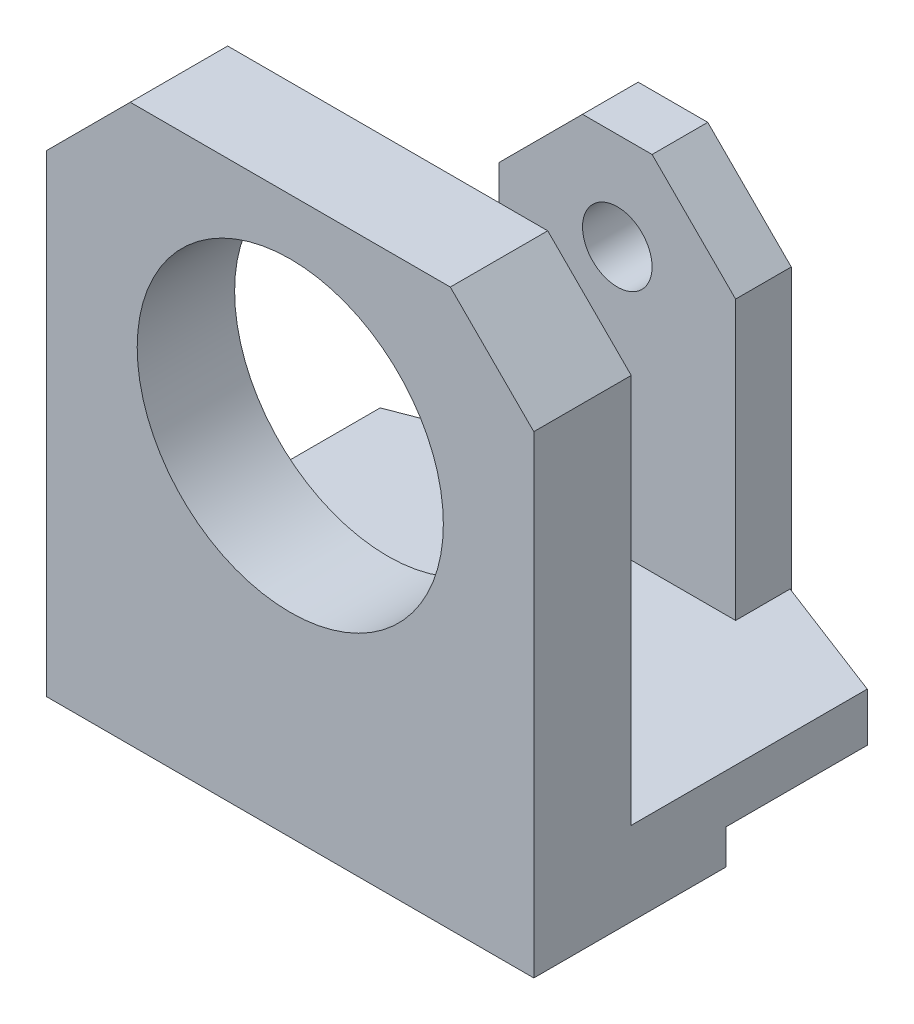
from build123d import *

# Parameters (mm, degrees)
SKETCH1_W           = 35
SKETCH1_H           = 40
SKETCH1_R           = 11
BOSS_EXTRUDE1_DEPTH = 7
SKETCH2_W           = 35
SKETCH2_H           = 6
BOSS_EXTRUDE2_DEPTH = 16.5
SKETCH3_W           = 17
SKETCH3_H           = 32
SKETCH3_R           = 2.5
BOSS_EXTRUDE3_DEPTH = 4
CHAMFER1_SIZE       = 10.2
CHAMFER1_SIZE_2     = 3.915413157
CHAMFER2_SIZE       = 6
SKETCH4_W           = 35
SKETCH4_H           = 2.5
CUT_EXTRUDE1_DEPTH  = 13.7


with BuildPart() as part:
    # Sketch1 → Boss-Extrude1 (new body)
    with BuildSketch(Plane.XY):
        with Locations((0, -5)):
            Rectangle(SKETCH1_W, SKETCH1_H)
        Circle(SKETCH1_R, mode=Mode.SUBTRACT)
    extrude(amount=BOSS_EXTRUDE1_DEPTH)

    # Sketch2 → Boss-Extrude2 (add)
    with BuildSketch(Plane(origin=(0, 0, 0), x_dir=(-1, 0, 0), z_dir=(0, 0, -1))):
        with Locations((0, -22)):
            Rectangle(SKETCH2_W, SKETCH2_H)
    extrude(amount=BOSS_EXTRUDE2_DEPTH)

    # Sketch3 → Boss-Extrude3 (add)
    with BuildSketch(Plane(origin=(0, 0, -16.5), x_dir=(-1, 0, 0), z_dir=(0, 0, -1))):
        with Locations((0, -9)):
            Rectangle(SKETCH3_W, SKETCH3_H)
        Circle(SKETCH3_R, mode=Mode.SUBTRACT)
    extrude(amount=BOSS_EXTRUDE3_DEPTH)

    # Chamfer1
    # the kernel refuses this chamfer: 10.2, 3.915413157 mm, written as the material it adds along each edge
    with BuildSketch(Plane(origin=(-8.5, -19, -16.5), x_dir=(-0.9999045356599434, 0, 0.013817364679016049), z_dir=(0, -1, 0))) as chamfer1_piece_1_section:
        Polygon((CHAMFER1_SIZE * 0.99990453566, CHAMFER1_SIZE * 0.013817364679), (-CHAMFER1_SIZE_2 * 0.0138173646803, CHAMFER1_SIZE_2 * 0.999904535752), (0, 0), align=None)
    chamfer1_piece_1 = extrude(amount=6, mode=Mode.PRIVATE)
    chamfer1_piece_1 = split(chamfer1_piece_1, bisect_by=Plane(origin=(-17.5, -22, -17.821300415), z_dir=(1, 0, 0)), keep=Keep.TOP, mode=Mode.PRIVATE)
    add(chamfer1_piece_1)
    with BuildSketch(Plane(origin=(8.5, -25, -16.5), x_dir=(0.9999045356599434, 0, 0.013817364679016049), z_dir=(0, 1, 0))) as chamfer1_piece_2_section:
        Polygon((CHAMFER1_SIZE * 0.99990453566, CHAMFER1_SIZE * 0.013817364679), (-CHAMFER1_SIZE_2 * 0.0138173646803, CHAMFER1_SIZE_2 * 0.999904535752), (0, 0), align=None)
    chamfer1_piece_2 = extrude(amount=6, mode=Mode.PRIVATE)
    chamfer1_piece_2 = split(chamfer1_piece_2, bisect_by=Plane(origin=(17.5, -22, -17.821300415), z_dir=(-1, 0, 0)), keep=Keep.TOP, mode=Mode.PRIVATE)
    add(chamfer1_piece_2)

    # Chamfer2
    chamfer2_edges = [part.edges().sort_by_distance(p)[0] for p in [
        (-8.5, 7, -18.5),
        (8.5, 7, -18.5),
        (17.5, 15, 3.5),
        (-17.5, 15, 3.5),
    ]]
    chamfer(chamfer2_edges, length=CHAMFER2_SIZE)

    # Sketch4 → Cut-Extrude1 (cut)
    with BuildSketch(Plane(origin=(0, 0, -20.5), x_dir=(-1, 0, 0), z_dir=(0, 0, -1))):
        with Locations((0, -23.75)):
            Rectangle(SKETCH4_W, SKETCH4_H)
    extrude(amount=-CUT_EXTRUDE1_DEPTH, mode=Mode.SUBTRACT)


solid = part.part
